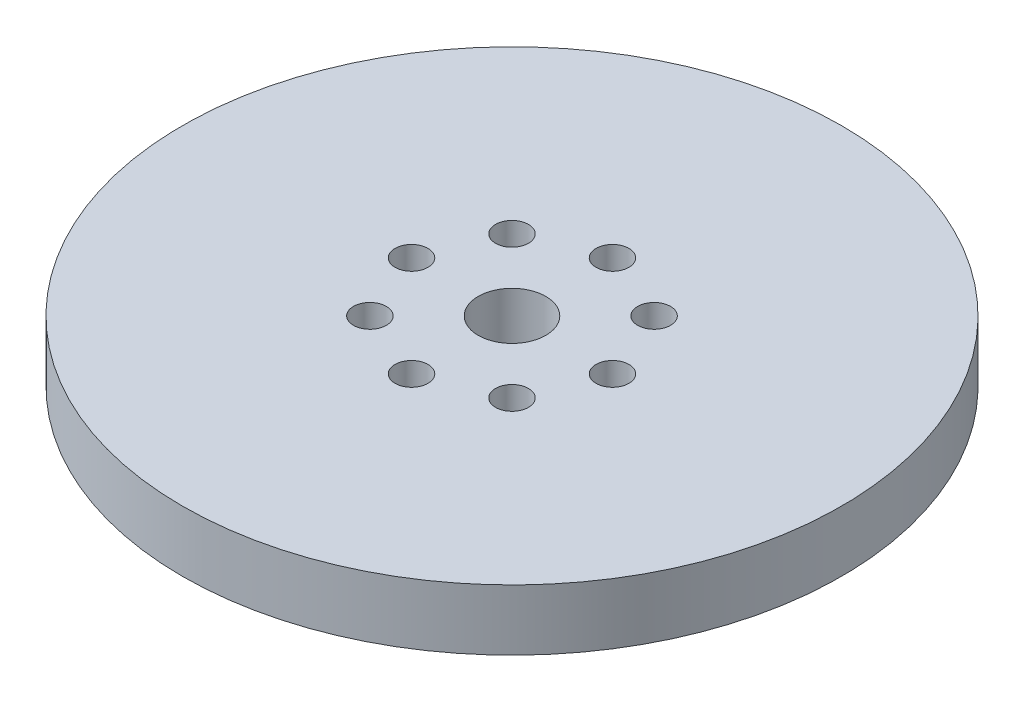
from build123d import *

# Parameters (mm, degrees)
SKETCH1_R           = 97.5
BOSS_EXTRUDE1_DEPTH = 18
SKETCH2_R           = 10
CUT_EXTRUDE1_DEPTH  = 140.055744218
SKETCH3_R           = 4.865138475
CUT_EXTRUDE2_DEPTH  = 14.67342045
CIRPATTERN1_COUNT   = 8


with BuildPart() as part:
    # Sketch1 → Boss-Extrude1 (new body)
    with BuildSketch(Plane(origin=(0, 0, 0), x_dir=(1, 0, 0), z_dir=(0, 1, 0))):
        Circle(SKETCH1_R)
    extrude(amount=BOSS_EXTRUDE1_DEPTH)

    # Sketch2 → Cut-Extrude1 (cut, through all)
    with BuildSketch(Plane(origin=(0, 0, 0), x_dir=(1, 0, 0), z_dir=(0, 1, 0))):
        Circle(SKETCH2_R)
    extrude(amount=CUT_EXTRUDE1_DEPTH, mode=Mode.SUBTRACT)

    # Sketch3 → Cut-Extrude2 (cut)
    with BuildSketch(Plane(origin=(0, 18, 0), x_dir=(1, 0, 0), z_dir=(0, 1, 0))):
        with Locations((-29.725551757, 0)):
            Circle(SKETCH3_R)
    cut_extrude2 = extrude(amount=-CUT_EXTRUDE2_DEPTH, mode=Mode.SUBTRACT)

    # CirPattern1: Cut-Extrude2 ×8 about axis
    cirpattern1_axis = Axis((0, 0, 0), (0, 1, 0))
    for i in range(1, CIRPATTERN1_COUNT):
        add(cut_extrude2.rotate(cirpattern1_axis, i * 360 / CIRPATTERN1_COUNT), mode=Mode.SUBTRACT)


solid = part.part
